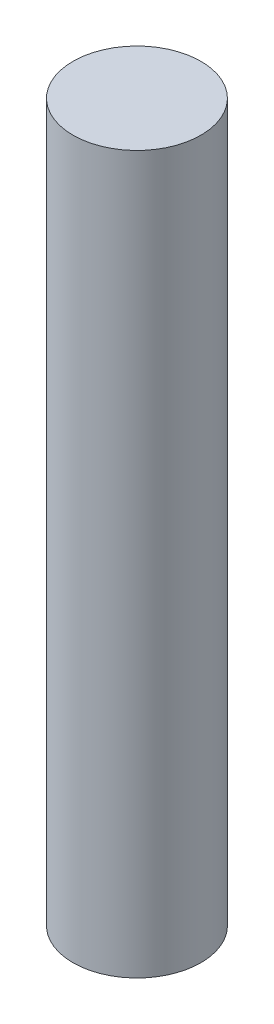
from build123d import *

# Parameters (mm, degrees)
SKETCH1_R           = 3.175
BOSS_EXTRUDE1_DEPTH = 35.56


with BuildPart() as part:
    # Sketch1 → Boss-Extrude1 (new body)
    with BuildSketch(Plane(origin=(0, 0, 0), x_dir=(1, 0, 0), z_dir=(0, 1, 0))):
        Circle(SKETCH1_R)
    extrude(amount=BOSS_EXTRUDE1_DEPTH)


solid = part.part
